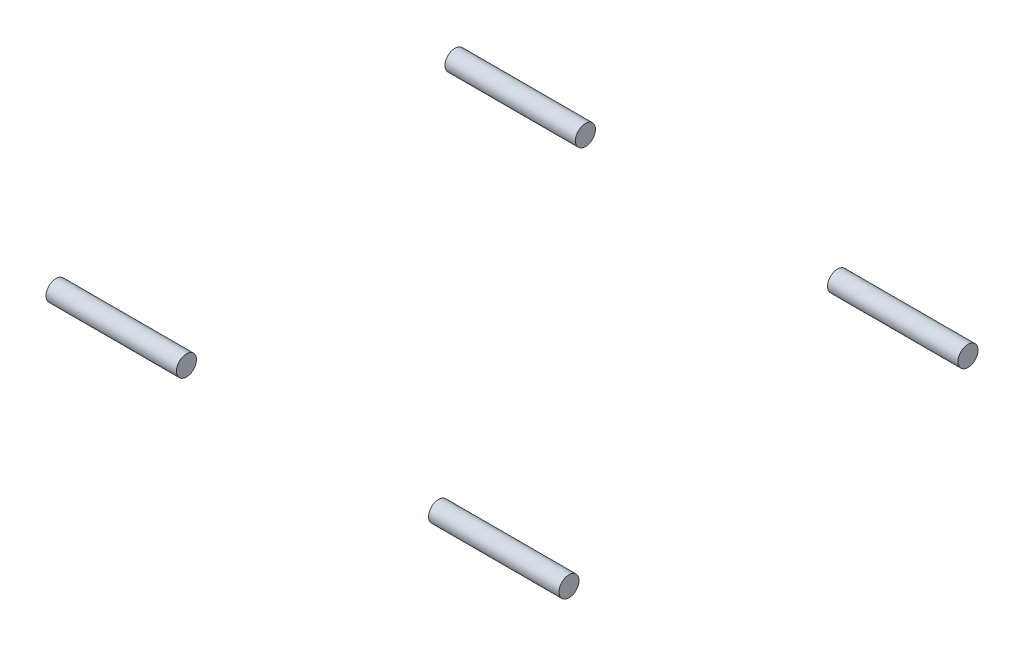
from build123d import *

# Parameters (mm, degrees)
SKETCH1_R             = 3.175
BOSS_EXTRUDE1_DEPTH   = 41.275
BOSS_EXTRUDE1_2_DEPTH = 41.275


with BuildPart() as part:
    # Sketch1 → Boss-Extrude1 (new body)
    with BuildSketch(Plane.ZY.offset(-81.164999976)):
        with Locations((126.249998656, 0)):
            Circle(SKETCH1_R)
    extrude(amount=BOSS_EXTRUDE1_DEPTH)


with BuildPart() as body_2:
    # Sketch1 → Boss-Extrude1 2 (new body)
    with BuildSketch(Plane.ZY.offset(-81.164999976)):
        Circle(SKETCH1_R)
    extrude(amount=BOSS_EXTRUDE1_2_DEPTH)


with BuildPart() as body_3:
    # Mirror1: mirrored copy
    add(part.part.mirror(Plane(origin=(0, 0, 0), x_dir=(0, 0, 1), z_dir=(1, 0, 0))))


with BuildPart() as body_4:
    # Mirror1 2: mirrored copy
    add(body_2.part.mirror(Plane(origin=(0, 0, 0), x_dir=(0, 0, 1), z_dir=(1, 0, 0))))


solid = Compound([part.part, body_2.part, body_3.part, body_4.part])
